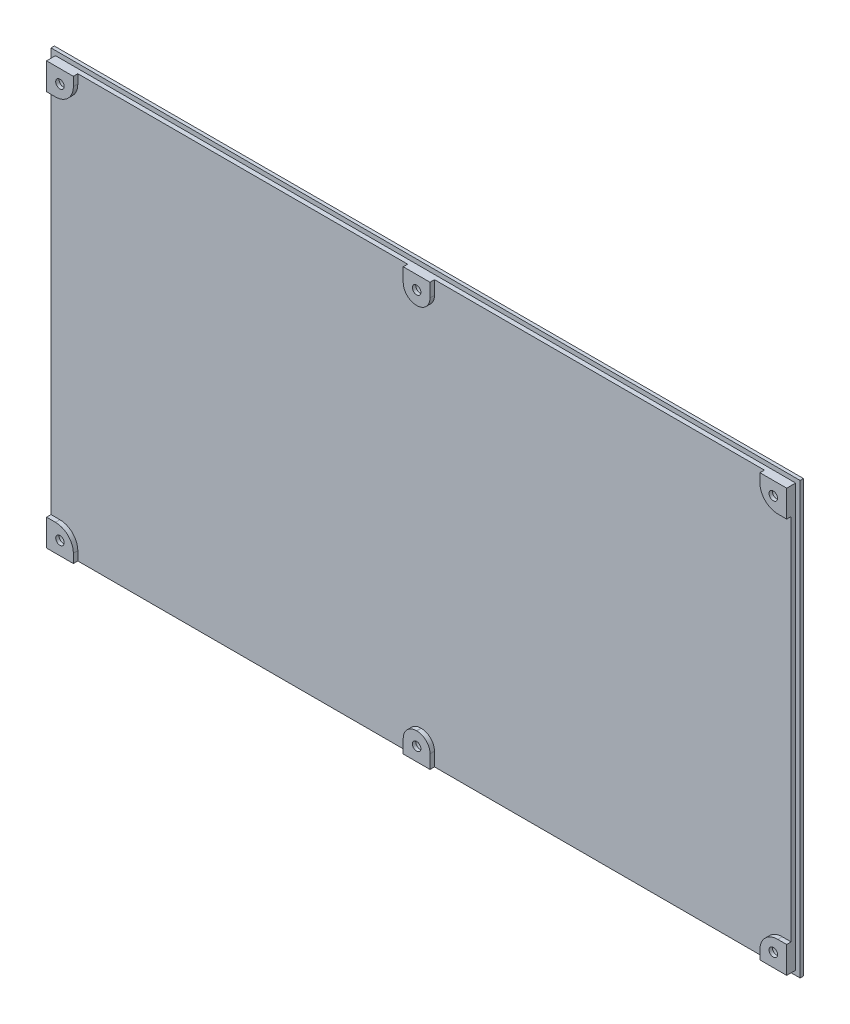
from build123d import *

# Parameters (mm, degrees)
SKETCH1_W           = 335.5
SKETCH1_H           = 193
BOSS_EXTRUDE1_DEPTH = 1.5
BOSS_EXTRUDE2_DEPTH = 2
BOSS_EXTRUDE3_DEPTH = 4
SKETCH5_R           = 4
CUT_EXTRUDE1_DEPTH  = 4
SKETCH6_R           = 1.9
CUT_EXTRUDE2_DEPTH  = 14


with BuildPart() as part:
    # Sketch1 → Boss-Extrude1 (new body)
    with BuildSketch(Plane.XY):
        Rectangle(SKETCH1_W, SKETCH1_H)
    extrude(amount=BOSS_EXTRUDE1_DEPTH)

    # Sketch2 → Boss-Extrude2 (add)
    with BuildSketch(Plane.XY.offset(1.5)):
        with BuildLine():
            Line((-153.75, -90.5), (-153.75, -94.5))
            Line((-153.75, -94.5), (-6, -94.5))
            Line((-6, -94.5), (-6, -88.4))
            ThreePointArc((-6, -88.4), (-4.271930009, -84.228069991), (-0.1, -82.5))
            Line((-0.1, -82.5), (0.1, -82.5))
            ThreePointArc((0.1, -82.5), (4.271930009, -84.228069991), (6, -88.4))
            Line((6, -88.4), (6, -94.5))
            Line((6, -94.5), (153.75, -94.5))
            Line((153.75, -94.5), (153.75, -90.5))
            ThreePointArc((153.75, -90.5), (156.093145751, -84.843145751), (161.75, -82.5))
            Line((161.75, -82.5), (165.75, -82.5))
            Line((165.75, -82.5), (165.75, 82.5))
            Line((165.75, 82.5), (161.75, 82.5))
            ThreePointArc((161.75, 82.5), (156.093145751, 84.843145751), (153.75, 90.5))
            Line((153.75, 90.5), (153.75, 94.5))
            Line((153.75, 94.5), (6, 94.5))
            Line((6, 94.5), (6, 88.4))
            ThreePointArc((6, 88.4), (4.271930009, 84.228069991), (0.1, 82.5))
            Line((0.1, 82.5), (-0.1, 82.5))
            ThreePointArc((-0.1, 82.5), (-4.271930009, 84.228069991), (-6, 88.4))
            Line((-6, 88.4), (-6, 94.5))
            Line((-6, 94.5), (-153.75, 94.5))
            Line((-153.75, 94.5), (-153.75, 90.5))
            ThreePointArc((-153.75, 90.5), (-156.093145751, 84.843145751), (-161.75, 82.5))
            Line((-161.75, 82.5), (-165.75, 82.5))
            Line((-165.75, 82.5), (-165.75, -82.5))
            Line((-165.75, -82.5), (-161.75, -82.5))
            ThreePointArc((-161.75, -82.5), (-156.093145751, -84.843145751), (-153.75, -90.5))
        make_face()
    extrude(amount=BOSS_EXTRUDE2_DEPTH)

    # Sketch4 → Boss-Extrude3 (add)
    with BuildSketch(Plane.XY.offset(1.5)):
        with BuildLine():
            Line((-161.75, -82.5), (-165.75, -82.5))
            Line((-165.75, -82.5), (-165.75, -94.5))
            Line((-165.75, -94.5), (-153.75, -94.5))
            Line((-153.75, -94.5), (-153.75, -90.5))
            ThreePointArc((-153.75, -90.5), (-156.093145751, -84.843145751), (-161.75, -82.5))
        make_face()
        with BuildLine():
            ThreePointArc((-0.1, -82.5), (-4.271930009, -84.228069991), (-6, -88.4))
            Line((-6, -88.4), (-6, -94.5))
            Line((-6, -94.5), (6, -94.5))
            Line((6, -94.5), (6, -88.4))
            ThreePointArc((6, -88.4), (4.271930009, -84.228069991), (0.1, -82.5))
            Line((0.1, -82.5), (-0.1, -82.5))
        make_face()
        with BuildLine():
            Line((153.75, -90.5), (153.75, -94.5))
            Line((153.75, -94.5), (165.75, -94.5))
            Line((165.75, -94.5), (165.75, -82.5))
            Line((165.75, -82.5), (161.75, -82.5))
            ThreePointArc((161.75, -82.5), (156.093145751, -84.843145751), (153.75, -90.5))
        make_face()
        with BuildLine():
            Line((161.75, 82.5), (165.75, 82.5))
            Line((165.75, 82.5), (165.75, 94.5))
            Line((165.75, 94.5), (153.75, 94.5))
            Line((153.75, 94.5), (153.75, 90.5))
            ThreePointArc((153.75, 90.5), (156.093145751, 84.843145751), (161.75, 82.5))
        make_face()
        with BuildLine():
            ThreePointArc((0.1, 82.5), (4.271930009, 84.228069991), (6, 88.4))
            Line((6, 88.4), (6, 94.5))
            Line((6, 94.5), (-6, 94.5))
            Line((-6, 94.5), (-6, 88.4))
            ThreePointArc((-6, 88.4), (-4.271930009, 84.228069991), (-0.1, 82.5))
            Line((-0.1, 82.5), (0.1, 82.5))
        make_face()
        with BuildLine():
            Line((-165.75, 94.5), (-165.75, 82.5))
            Line((-165.75, 82.5), (-161.75, 82.5))
            ThreePointArc((-161.75, 82.5), (-156.093145751, 84.843145751), (-153.75, 90.5))
            Line((-153.75, 90.5), (-153.75, 94.5))
            Line((-153.75, 94.5), (-165.75, 94.5))
        make_face()
    extrude(amount=BOSS_EXTRUDE3_DEPTH)

    # Sketch5 → Cut-Extrude1 (cut)
    with BuildSketch(Plane(origin=(0, 0, 0), x_dir=(-1, 0, 0), z_dir=(0, 0, -1))):
        with Locations((-159.75, 88.5)):
            Circle(SKETCH5_R)
        with Locations((0, 88.5)):
            Circle(SKETCH5_R)
        with Locations((0, -88.5)):
            Circle(SKETCH5_R)
        with Locations((159.75, 88.5)):
            Circle(SKETCH5_R)
        with Locations((159.75, -88.5)):
            Circle(SKETCH5_R)
        with Locations((-159.75, -88.5)):
            Circle(SKETCH5_R)
    extrude(amount=-CUT_EXTRUDE1_DEPTH, mode=Mode.SUBTRACT)

    # Sketch6 → Cut-Extrude2 (cut)
    with BuildSketch(Plane(origin=(0, 0, 0), x_dir=(-1, 0, 0), z_dir=(0, 0, -1))):
        with Locations((-159.75, -88.5)):
            Circle(SKETCH6_R)
        with Locations((0, -88.5)):
            Circle(SKETCH6_R)
        with Locations((159.75, -88.5)):
            Circle(SKETCH6_R)
        with Locations((159.75, 88.5)):
            Circle(SKETCH6_R)
        with Locations((0, 88.5)):
            Circle(SKETCH6_R)
        with Locations((-159.75, 88.5)):
            Circle(SKETCH6_R)
    extrude(amount=-CUT_EXTRUDE2_DEPTH, mode=Mode.SUBTRACT)


solid = part.part
